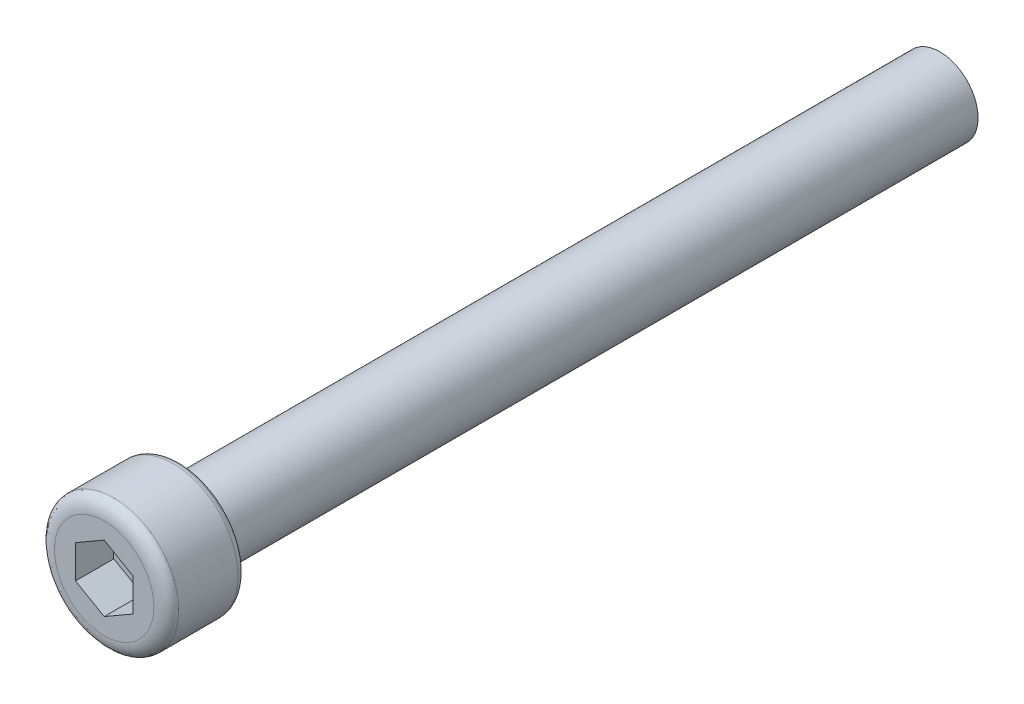
from build123d import *

# Parameters (mm, degrees)
CHAMFER_1_SIZE      = 0.3
CHAMFER_1_SIZE2     = 0.519615242
FILLET_1_R          = 0.4
FILLET_2_SIZE       = 0.5
FILLET_2_SIZE_2     = 0.8
CUT_EXTRUDE_1_DEPTH = 2


with BuildPart() as part:
    # 草图2 → 旋转1 (revolve)
    with BuildSketch(Plane(origin=(0, 0, 0), x_dir=(0, 0, -1), z_dir=(1, 0, 0)), mode=Mode.PRIVATE) as revolve_1_sk:
        Polygon((-22, 0), (-22, 3.4), (-18, 3.4), (-18, 2), (22, 2), (22, 0), align=None)
    revolve(revolve_1_sk.sketch.rotate(Axis((0, 0, -22), (0, 0, 1)), 90), axis=Axis((0, 0, -22), (0, 0, 1)))

    # 倒角1
    chamfer_1_edges = [part.edges().sort_by_distance(p)[0] for p in [
        (2, 0, -22),
    ]]
    chamfer_1_side = [part.faces().sort_by_distance(p)[0] for p in [
        (2, 0, -2),
    ]]
    chamfer(chamfer_1_edges, length=CHAMFER_1_SIZE, length2=CHAMFER_1_SIZE2, reference=chamfer_1_side[0])

    # 圆角1
    fillet_1_edges = [part.edges().sort_by_distance(p)[0] for p in [
        (3.4, 0, 18),
    ]]
    fillet(fillet_1_edges, radius=FILLET_1_R)

    # 圆角2
    # an asymmetric fillet: 0.8, 0.5 mm, written as the material it takes off along each edge
    with BuildSketch(Plane(origin=(0, 0, 22), x_dir=(-1, 0, 0), z_dir=(0, 1, 0))) as fillet_2_piece_1:
        with BuildLine():
            Bezier((3.4, -FILLET_2_SIZE), (3.4, 0), (3.4 - FILLET_2_SIZE_2, 0), weights=[1, 0.707106781, 1])
            Line((3.4 - FILLET_2_SIZE_2, 0), (3.4, 0))
            Line((3.4, 0), (3.4, -FILLET_2_SIZE))
        make_face()
    revolve(axis=Axis((0, 0, 22), (0, 0, 1)), mode=Mode.SUBTRACT)

    # 草图3 → 切除-拉伸1 (cut)
    with BuildSketch(Plane.XY.offset(22)):
        Polygon((0, 1.732050808), (-1.5, 0.866025404), (-1.5, -0.866025404), (0, -1.732050808), (1.5, -0.866025404), (1.5, 0.866025404), align=None)
    extrude(amount=-CUT_EXTRUDE_1_DEPTH, mode=Mode.SUBTRACT)


solid = part.part
